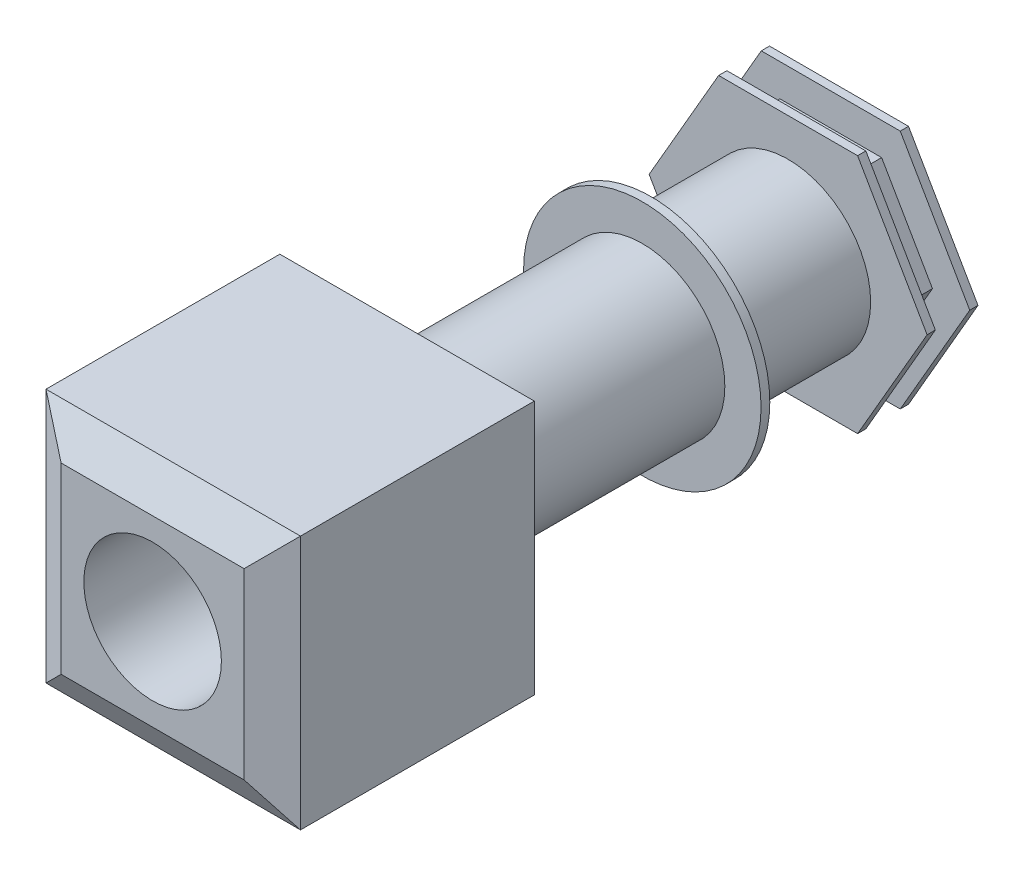
from build123d import *
from OCP.BRepFilletAPI import BRepFilletAPI_MakeChamfer

# Parameters (mm, degrees)
BOSS_EXTRUDE1_DEPTH = 12
BOSS_EXTRUDE2_DEPTH = 50
BOSS_EXTRUDE3_DEPTH = 12
SKETCH4_R           = 120
BOSS_EXTRUDE4_DEPTH = 200
SKETCH5_R           = 172.646944325
BOSS_EXTRUDE5_DEPTH = 12
CHAMFER1_SIZE       = 56.712818196
CHAMFER1_SIZE_2     = 10
SKETCH6_R           = 120
BOSS_EXTRUDE6_DEPTH = 330
SKETCH8_R           = 172.646944325
BOSS_EXTRUDE7_DEPTH = 12
CHAMFER2_SIZE       = 6
CHAMFER2_SIZE2      = 16.484864517
SKETCH9_W           = 370
SKETCH9_H           = 370
BOSS_EXTRUDE8_DEPTH = 370
SKETCH10_R          = 100
CUT_EXTRUDE1_DEPTH  = 900
CHAMFER3_SIZE       = 30
CHAMFER3_SIZE2      = 51.961524227


with BuildPart() as part:
    # Sketch1 → Boss-Extrude1 (new body)
    with BuildSketch(Plane.XY):
        Polygon((202.072594216, 0), (101.036297108, 175), (-101.036297108, 175), (-202.072594216, 0), (-101.036297108, -175), (101.036297108, -175), align=None)
    extrude(amount=BOSS_EXTRUDE1_DEPTH)

    # Sketch2 → Boss-Extrude2 (add)
    with BuildSketch(Plane.XY.offset(12)):
        Polygon((147.887498821, 0), (73.943749411, 128.074330881), (-73.943749411, 128.074330881), (-147.887498821, 0), (-73.943749411, -128.074330881), (73.943749411, -128.074330881), align=None)
    extrude(amount=BOSS_EXTRUDE2_DEPTH)

    # Sketch3 → Boss-Extrude3 (add)
    with BuildSketch(Plane.XY.offset(62)):
        Polygon((202.072594216, 0), (101.036297108, 175), (-101.036297108, 175), (-202.072594216, 0), (-101.036297108, -175), (101.036297108, -175), align=None)
    extrude(amount=BOSS_EXTRUDE3_DEPTH)

    # Sketch4 → Boss-Extrude4 (add)
    with BuildSketch(Plane.XY.offset(74)):
        Circle(SKETCH4_R)
    extrude(amount=BOSS_EXTRUDE4_DEPTH)

    # Sketch5 → Boss-Extrude5 (add)
    with BuildSketch(Plane.XY.offset(274)):
        Circle(SKETCH5_R)
    extrude(amount=BOSS_EXTRUDE5_DEPTH)

    # Chamfer1
    # the kernel refuses this chamfer: 56.712818196, 10 mm, written as the material it adds along each edge
    with BuildSketch(Plane(origin=(0, 0, 274), x_dir=(1, 0, 0), z_dir=(0, -1, 0))) as chamfer1_piece_1_section:
        Polygon((120 + CHAMFER1_SIZE, 0), (120, -CHAMFER1_SIZE_2), (120, 0), align=None)
    chamfer1_piece_1 = revolve(axis=Axis((0, 0, 274), (0, 0, 1)), mode=Mode.PRIVATE)
    chamfer1_piece_1 = chamfer1_piece_1 & Plane(origin=(0, 0, 269.114385433), x_dir=(1, 0, 0), z_dir=(0, 0, -1)) * Cylinder(172.646944325, 707, mode=Mode.PRIVATE)
    add(chamfer1_piece_1)

    # Sketch6 → Boss-Extrude6 (add)
    with BuildSketch(Plane.XY.offset(286)):
        Circle(SKETCH6_R)
    extrude(amount=BOSS_EXTRUDE6_DEPTH)

    # Sketch8 → Boss-Extrude7 (add)
    with BuildSketch(Plane.XY.offset(616)):
        Circle(SKETCH8_R)
    extrude(amount=BOSS_EXTRUDE7_DEPTH)

    # Chamfer2
    chamfer2_edges = [part.edges().sort_by_distance(p)[0] for p in [
        (-120, 0, 616),
    ]]
    chamfer2_side = [part.faces().sort_by_distance(p)[0] for p in [
        (-120, 0, 451),
    ]]
    chamfer(chamfer2_edges, length=CHAMFER2_SIZE, length2=CHAMFER2_SIZE2, reference=chamfer2_side[0])

    # Sketch9 → Boss-Extrude8 (add)
    with BuildSketch(Plane.XY.offset(628)):
        Rectangle(SKETCH9_W, SKETCH9_H)
    extrude(amount=BOSS_EXTRUDE8_DEPTH)

    # Sketch10 → Cut-Extrude1 (cut)
    with BuildSketch(Plane.XY.offset(998)):
        Circle(SKETCH10_R)
    extrude(amount=-CUT_EXTRUDE1_DEPTH, mode=Mode.SUBTRACT)

    # Chamfer3: one chamfer whose edges measure the first distance from different faces: ONE call of the kernel's chamfer builder (chamfer() names one face for all edges)
    chamfer3_edges_1 = [part.edges().sort_by_distance(p)[0] for p in [
        (185, 0, 998),
    ]]
    chamfer3_side_1 = [part.faces().sort_by_distance(p)[0] for p in [
        (185, 0, 813),
    ]]
    chamfer3_edges_2 = [part.edges().sort_by_distance(p)[0] for p in [
        (0, 185, 998),
    ]]
    chamfer3_side_2 = [part.faces().sort_by_distance(p)[0] for p in [
        (0, 185, 813),
    ]]
    chamfer3_edges_3 = [part.edges().sort_by_distance(p)[0] for p in [
        (-185, 0, 998),
    ]]
    chamfer3_side_3 = [part.faces().sort_by_distance(p)[0] for p in [
        (-185, 0, 813),
    ]]
    chamfer3_edges_4 = [part.edges().sort_by_distance(p)[0] for p in [
        (0, -185, 998),
    ]]
    chamfer3_side_4 = [part.faces().sort_by_distance(p)[0] for p in [
        (0, -185, 813),
    ]]
    chamfer3 = BRepFilletAPI_MakeChamfer(part.part.solid().wrapped)
    for e in chamfer3_edges_1:
        chamfer3.Add(CHAMFER3_SIZE, CHAMFER3_SIZE2, e.wrapped, chamfer3_side_1[0].wrapped)  # the first distance lies on this face
    for e in chamfer3_edges_2:
        chamfer3.Add(CHAMFER3_SIZE, CHAMFER3_SIZE2, e.wrapped, chamfer3_side_2[0].wrapped)  # the first distance lies on this face
    for e in chamfer3_edges_3:
        chamfer3.Add(CHAMFER3_SIZE, CHAMFER3_SIZE2, e.wrapped, chamfer3_side_3[0].wrapped)  # the first distance lies on this face
    for e in chamfer3_edges_4:
        chamfer3.Add(CHAMFER3_SIZE, CHAMFER3_SIZE2, e.wrapped, chamfer3_side_4[0].wrapped)  # the first distance lies on this face
    add(Compound.cast(chamfer3.Shape()), mode=Mode.REPLACE)


solid = part.part
